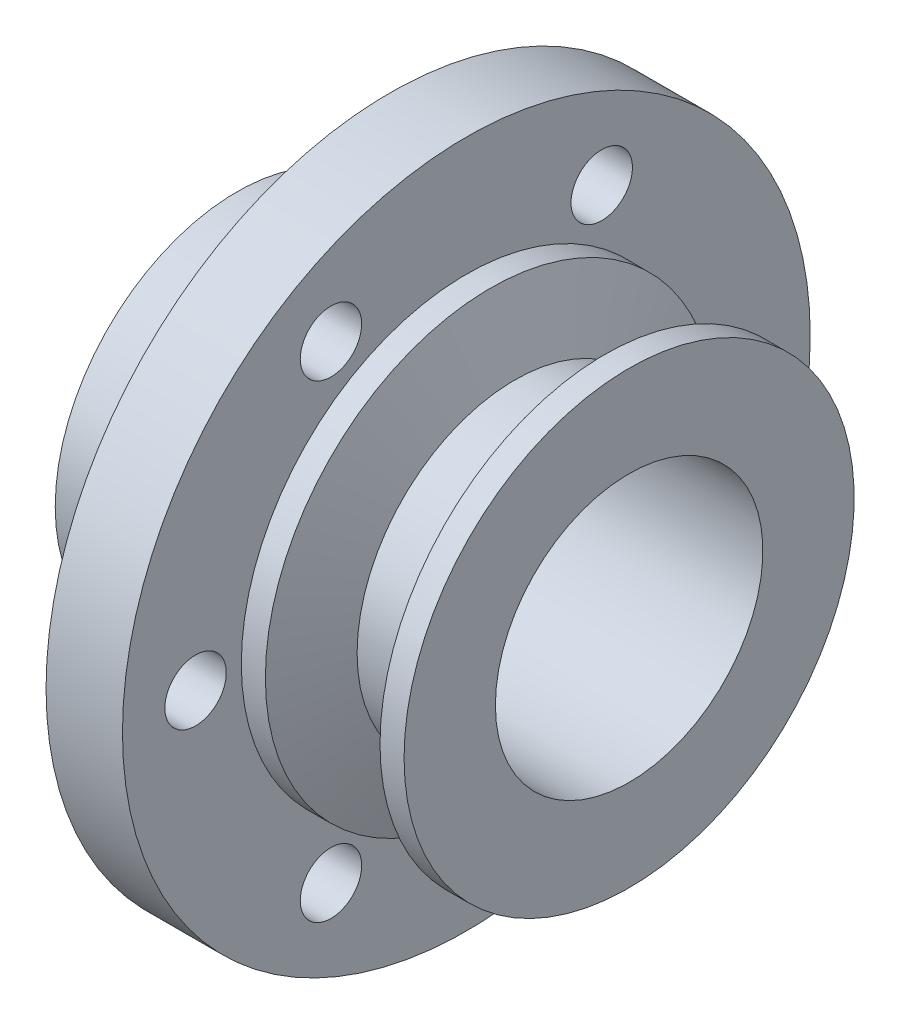
from build123d import *

# Parameters (mm, degrees)
F_1_4_20_TAPPED_HOLE1_D     = 5.1054
F_1_4_20_TAPPED_HOLE1_DEPTH = 16.51
F_1_4_20_TAPPED_HOLE1_TIP   = 1.533816902


with BuildPart() as part:
    # Sketch1 → Revolve1 (revolve)
    with BuildSketch(Plane.XY):
        Polygon((-12.7, 15.112500017), (0, 15.112500017), (0, 28.575), (6.35, 28.575), (6.35, 18.7005), (8.35, 18.7005), (10.383865669, 13.1125), (15.841134331, 13.1125), (17.875, 18.7005), (19.875000096, 18.7005), (19.875000096, 11.1125), (4.000000096, 11.1125), (4.000000096, 8.9375), (1.5875, 8.9375), (1.5875, 11.1125), (-12.7, 11.1125), align=None)
    revolve(axis=Axis((0, 0, 0), (1, 0, 0)))

    # 1/4-20 Tapped Hole1
    with Locations(Plane.ZY):
        with Locations((-11.25, -19.485571585), (-22.5, 0), (-11.25, 19.485571585), (11.25, 19.485571585), (22.5, 0), (11.25, -19.485571585)):
            Hole(F_1_4_20_TAPPED_HOLE1_D / 2, depth=F_1_4_20_TAPPED_HOLE1_DEPTH)
            with Locations((0, 0, -(F_1_4_20_TAPPED_HOLE1_DEPTH + F_1_4_20_TAPPED_HOLE1_TIP / 2))):  # 118° drill point
                Cone(0, F_1_4_20_TAPPED_HOLE1_D / 2, F_1_4_20_TAPPED_HOLE1_TIP, mode=Mode.SUBTRACT)


solid = part.part
